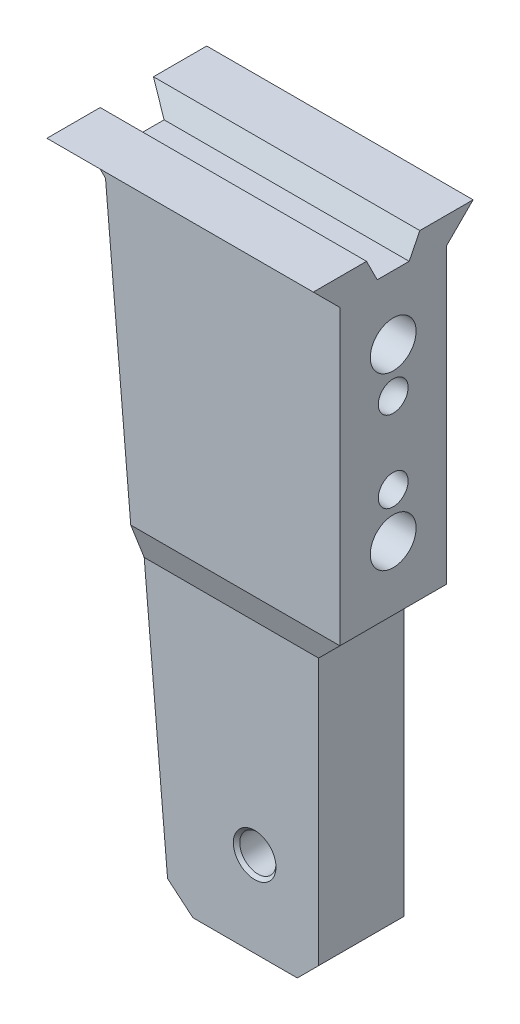
from build123d import *
from OCP.BRepFilletAPI import BRepFilletAPI_MakeChamfer

# Parameters (mm, degrees)
BODY_DEPTH                 = 15
SHAPE_CUT_DEPTH            = 67.708320321
RAIL_CUTOUT_DEPTH          = 67.708320321
GUIDING_SCREWS_START       = 3.087719198
GUIDING_SCREWS_OUTLINE_R   = 4
GUIDING_SCREWS_DEPTH       = 11.912280802
GUIDING_SCREWS_START_2     = 15
GUIDING_SCREWS_2_OUTLINE_R = 2.15
GUIDING_SCREWS_2_DEPTH     = 10
SKETCH6_R                  = 1.4
TONG_TIP_CHAMFERS_SIZE     = 2
TONG_TIP_CHAMFERS_SIZE2    = 2.200726077


# Read off the part's stored shape, not the designer's step: guiding_screws
with BuildPart() as part:
    # Sketch1 → body (new body)
    with BuildSketch(Plane.XY):
        Polygon((0, 0), (25, 0), (25, -30), (22, -33), (22, -60), (8, -60), (3, -3), align=None)
    extrude(amount=BODY_DEPTH)

    # Sketch2 → shape_cut (cut, through all)
    with BuildSketch(Plane(origin=(25, 0, 0), x_dir=(0, 0, -1), z_dir=(1, 0, 0))):
        Polygon((-15, 0), (-12.5, -2.5), (-12.5, -30), (-11.5, -33), (-11.5, -60), (-15, -60), align=None)
        Polygon((0, 0), (-2.5, -2.5), (-2.5, -30), (-3.5, -33), (-3.5, -60), (0, -60), align=None)
    extrude(amount=-SHAPE_CUT_DEPTH, mode=Mode.SUBTRACT)

    # Sketch3 → rail_cutout (cut, through all)
    with BuildSketch(Plane(origin=(25, 0, 0), x_dir=(0, 0, -1), z_dir=(1, 0, 0))):
        Polygon((-10, 0), (-5, 0), (-6, -2), (-9, -2), align=None)
    extrude(amount=-RAIL_CUTOUT_DEPTH, mode=Mode.SUBTRACT)

    # guiding_screws outline → guiding_screws (cut)
    with BuildSketch(Plane.YZ.offset(GUIDING_SCREWS_START)):
        with Locations((-24, 7.5)):
            Circle(GUIDING_SCREWS_OUTLINE_R)
        with Locations((-8, 7.5)):
            Circle(GUIDING_SCREWS_OUTLINE_R)
    extrude(amount=GUIDING_SCREWS_DEPTH, mode=Mode.SUBTRACT)

    # guiding_screws 2 outline → guiding_screws 2 (cut)
    with BuildSketch(Plane.YZ.offset(GUIDING_SCREWS_START_2)):
        with Locations((-24, 7.5)):
            Circle(GUIDING_SCREWS_2_OUTLINE_R)
        with Locations((-8, 7.5)):
            Circle(GUIDING_SCREWS_2_OUTLINE_R)
    extrude(amount=GUIDING_SCREWS_2_DEPTH, mode=Mode.SUBTRACT)

    # Sketch6 → rope_connector_cutout (revolve, cut)
    with BuildSketch(Plane(origin=(25, 0, 0), x_dir=(0, 0, -1), z_dir=(1, 0, 0)), mode=Mode.PRIVATE) as rope_connector_cutout_sk:
        with Locations((-7.5, -12.2)):
            Circle(SKETCH6_R)
    revolve(rope_connector_cutout_sk.sketch.rotate(Axis((25, -16, 12.5), (0, 0, -1)), 270), axis=Axis((25, -16, 12.5), (0, 0, -1)), mode=Mode.SUBTRACT)

    # tong_tip_chamfers: one chamfer whose edges measure the first distance from different faces: ONE call of the kernel's chamfer builder (chamfer() names one face for all edges)
    tong_tip_chamfers_edges_1 = [part.edges().sort_by_distance(p)[0] for p in [
        (22, -60, 7.5),
    ]]
    tong_tip_chamfers_edges_2 = [part.edges().sort_by_distance(p)[0] for p in [
        (8, -60, 7.5),
    ]]
    tong_tip_chamfers_side_2 = [part.faces().sort_by_distance(p)[0] for p in [
        (5.65880617, -33.310390339, 7.5),
    ]]
    tong_tip_chamfers = BRepFilletAPI_MakeChamfer(part.part.solid().wrapped)
    for e in tong_tip_chamfers_edges_1:
        tong_tip_chamfers.Add(TONG_TIP_CHAMFERS_SIZE, e.wrapped)
    for e in tong_tip_chamfers_edges_2:
        tong_tip_chamfers.Add(TONG_TIP_CHAMFERS_SIZE, TONG_TIP_CHAMFERS_SIZE2, e.wrapped, tong_tip_chamfers_side_2[0].wrapped)  # the first distance lies on this face
    add(Compound.cast(tong_tip_chamfers.Shape()), mode=Mode.REPLACE)

    # Sketch9 → tong_tip_hole (revolve, cut)
    with BuildSketch(Plane(origin=(16, -52, 11.5), x_dir=(0, -1, 0), z_dir=(1, 0, 0))):
        Polygon((0, 0), (0, 8), (2, 8), (1.7, 7.7), (1.7, 0.3), (2, 0), align=None)
    revolve(axis=Axis((16, -52, 17.85), (0, 0, -1)), mode=Mode.SUBTRACT)


solid = part.part
